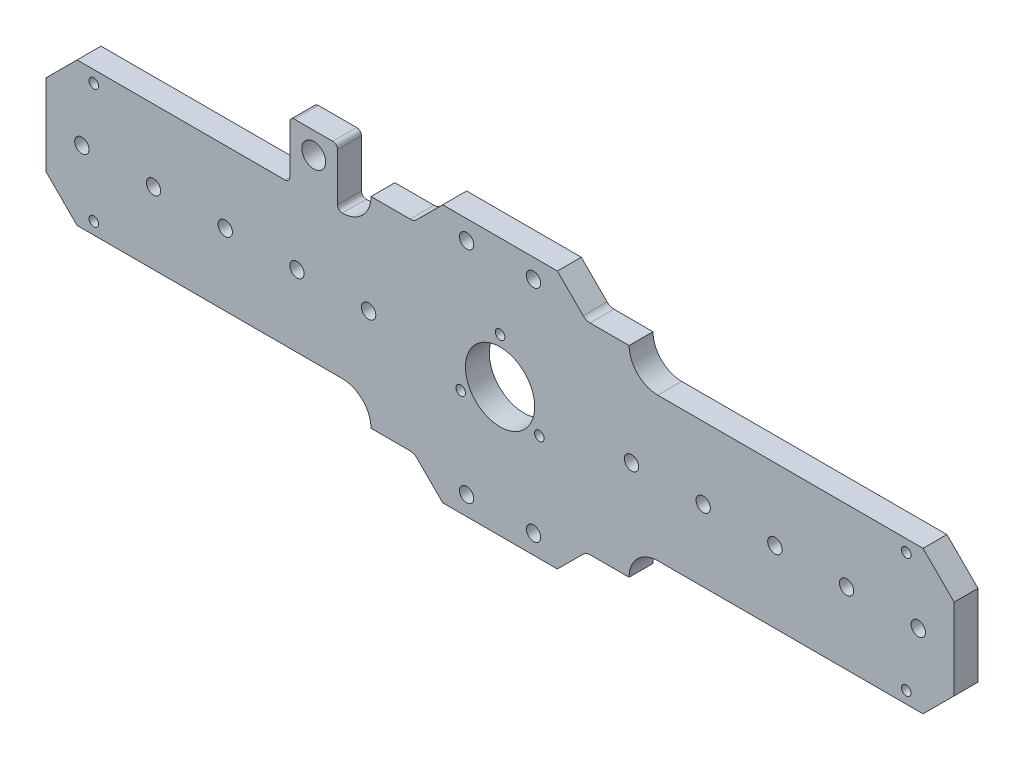
from build123d import *

# Parameters (mm, degrees)
SKETCH_1_R          = 1
SKETCH_1_R_2        = 7.25
EXTRUDE_1_DEPTH     = 5
SKETCH_2_R          = 1.5
CUT_EXTRUDE_1_DEPTH = 10
SKETCH_3_R          = 1.5
CUT_EXTRUDE_2_DEPTH = 10
FILLET_1_R          = 2
CHAMFER_1_SIZE      = 6.5
SKETCH_4_R          = 1
CUT_EXTRUDE_3_DEPTH = 10
SKETCH_6_W          = 10
SKETCH_6_H          = 12
SKETCH_6_R          = 2.5
EXTRUDE_2_DEPTH     = 5
FILLET_2_R          = 1


with BuildPart() as part:
    # 草图1 → 凸台-拉伸1 (new body)
    with BuildSketch(Plane.XY):
        with BuildLine():
            Line((95, -15), (95, 15))
            Line((95, 15), (33, 15))
            ThreePointArc((33, 15), (28.757359313, 16.757359313), (27, 21))
            Line((27, 21), (18, 21))
            Line((18, 21), (12, 27))
            Line((12, 27), (-12, 27))
            Line((-12, 27), (-18, 21))
            Line((-18, 21), (-27, 21))
            ThreePointArc((-27, 21), (-28.757359313, 16.757359313), (-33, 15))
            Line((-33, 15), (-95, 15))
            Line((-95, 15), (-95, -15))
            Line((-95, -15), (-33, -15))
            ThreePointArc((-33, -15), (-28.757359313, -16.757359313), (-27, -21))
            Line((-27, -21), (-18, -21))
            Line((-18, -21), (-12, -27))
            Line((-12, -27), (12, -27))
            Line((12, -27), (18, -21))
            Line((18, -21), (27, -21))
            ThreePointArc((27, -21), (28.757359313, -16.757359313), (33, -15))
            Line((33, -15), (95, -15))
        make_face()
        with Locations((0, 9.5)):
            Circle(SKETCH_1_R, mode=Mode.SUBTRACT)
        Circle(SKETCH_1_R_2, mode=Mode.SUBTRACT)
        with Locations((8.227241336, -4.75)):
            Circle(SKETCH_1_R, mode=Mode.SUBTRACT)
        with Locations((-8.227241336, -4.75)):
            Circle(SKETCH_1_R, mode=Mode.SUBTRACT)
    extrude(amount=EXTRUDE_1_DEPTH)

    # 草图2 → 切除-拉伸1 (cut)
    with BuildSketch(Plane.XY.offset(5)):
        with Locations((7, 23)):
            Circle(SKETCH_2_R)
        with Locations((-7, 23)):
            Circle(SKETCH_2_R)
        with Locations((7, -23)):
            Circle(SKETCH_2_R)
        with Locations((-7, -23)):
            Circle(SKETCH_2_R)
    extrude(amount=-CUT_EXTRUDE_1_DEPTH, mode=Mode.SUBTRACT)

    # 草图3 → 切除-拉伸2 (cut)
    with BuildSketch(Plane.XY.offset(5)):
        with Locations((87.5, 0)):
            Circle(SKETCH_3_R)
        with Locations((72.5, 0)):
            Circle(SKETCH_3_R)
        with Locations((57.5, 0)):
            Circle(SKETCH_3_R)
        with Locations(Location((-57.5, 0, 0), (0, 0, 180))):
            Circle(SKETCH_3_R)
        with Locations(Location((-72.5, 0, 0), (0, 0, 180))):
            Circle(SKETCH_3_R)
        with Locations(Location((-87.5, 0, 0), (0, 0, 180))):
            Circle(SKETCH_3_R)
        with Locations((42.5, 0)):
            Circle(SKETCH_3_R)
        with Locations((27.5, 0)):
            Circle(SKETCH_3_R)
        with Locations(Location((-27.5, 0, 0), (0, 0, 180))):
            Circle(SKETCH_3_R)
        with Locations(Location((-42.5, 0, 0), (0, 0, 180))):
            Circle(SKETCH_3_R)
    extrude(amount=-CUT_EXTRUDE_2_DEPTH, mode=Mode.SUBTRACT)

    # 圆角1
    fillet_1_edges = [part.edges().sort_by_distance(p)[0] for p in [
        (18, -21, 2.5),
        (-18, -21, 2.5),
        (-18, 21, 2.5),
        (18, 21, 2.5),
    ]]
    fillet(fillet_1_edges, radius=FILLET_1_R)

    # 倒角1
    chamfer_1_edges = [part.edges().sort_by_distance(p)[0] for p in [
        (95, 15, 2.5),
        (95, -15, 2.5),
        (-95, -15, 2.5),
        (-95, 15, 2.5),
    ]]
    chamfer(chamfer_1_edges, length=CHAMFER_1_SIZE)

    # 草图4 → 切除-拉伸3 (cut)
    with BuildSketch(Plane.XY.offset(5)):
        with Locations((85, 12.5)):
            Circle(SKETCH_4_R)
        with Locations((85, -12.5)):
            Circle(SKETCH_4_R)
        with Locations(Location((-85, -12.5, 0), (0, 0, 180))):
            Circle(SKETCH_4_R)
        with Locations(Location((-85, 12.5, 0), (0, 0, 180))):
            Circle(SKETCH_4_R)
    extrude(amount=-CUT_EXTRUDE_3_DEPTH, mode=Mode.SUBTRACT)

    # 草图6 → 凸台-拉伸2 (add)
    with BuildSketch(Plane(origin=(0, 0, 0), x_dir=(-1, 0, 0), z_dir=(0, 0, -1))):
        with Locations((39, 21)):
            Rectangle(SKETCH_6_W, SKETCH_6_H)
        with Locations((38.97114317, 22.5)):
            Circle(SKETCH_6_R, mode=Mode.SUBTRACT)
    extrude(amount=-EXTRUDE_2_DEPTH)

    # 圆角2
    fillet_2_edges = [part.edges().sort_by_distance(p)[0] for p in [
        (-44, 15, 2.5),
        (-34, 15, 2.5),
    ]]
    fillet(fillet_2_edges, radius=FILLET_2_R - 0.0001)  # a hair under: the kernel refuses the full size
    fillet_2_2_edges = [part.edges().sort_by_distance(p)[0] for p in [
        (-34, 27, 2.5),
        (-44, 27, 2.5),
    ]]
    fillet(fillet_2_2_edges, radius=FILLET_2_R)


solid = part.part
